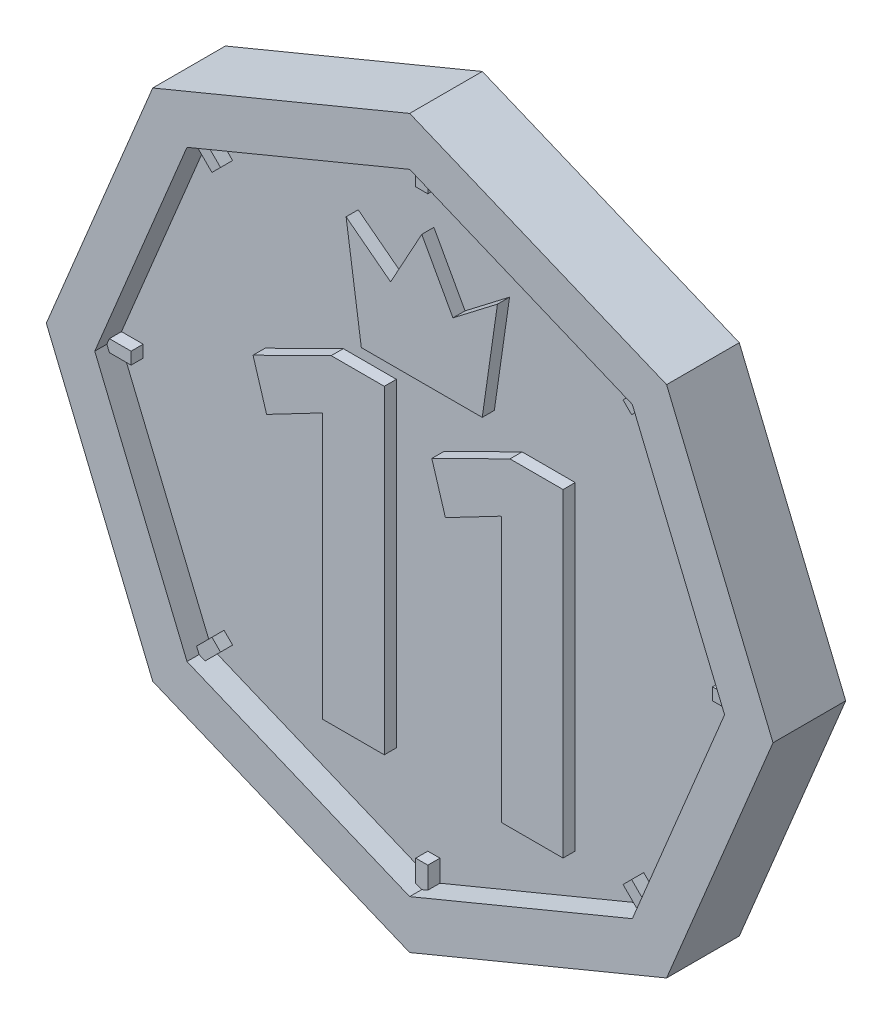
from build123d import *

# Parameters (mm, degrees)
BOSS_EXTRUDE2_DEPTH      = 2.54
BOSS_EXTRUDE3_DEPTH      = 5.08
BOSS_EXTRUDE3_DEPTH_BACK = 2.54
SKETCH2_W                = 1.27
SKETCH2_H                = 2.54
SKETCH2_W_2              = 2.54
SKETCH2_H_2              = 1.27
BOSS_EXTRUDE4_DEPTH      = 1.27
SKETCH4_W                = 46.629356418
SKETCH4_H                = 1.27
SKETCH4_W_2              = 1.27
SKETCH4_H_2              = 2.54
SKETCH4_W_3              = 2.54
BOSS_EXTRUDE5_DEPTH      = 1.27


with BuildPart() as part:
    # Sketch1 → Boss-Extrude2 (new body)
    with BuildSketch(Plane.XY):
        Polygon((23.348665915, -23.348665915), (33.02, 0), (23.348665915, 23.348665915), (0, 33.02), (-23.348665915, 23.348665915), (-33.02, 0), (-23.348665915, -23.348665915), (0, -33.02), align=None)
    extrude(amount=BOSS_EXTRUDE2_DEPTH)

    # Sketch1<3> → Boss-Extrude3 (add, two sides: drawn at the far end of the back side and taken through both)
    with BuildSketch(Plane.XY.offset(-BOSS_EXTRUDE3_DEPTH_BACK)):
        Polygon((-38.1, 0), (-26.940768363, -26.940768363), (0, -38.1), (26.940768363, -26.940768363), (38.1, 0), (26.940768363, 26.940768363), (0, 38.1), (-26.940768363, 26.940768363), align=None)
        Polygon((23.348665915, 23.348665915), (33.02, 0), (23.348665915, -23.348665915), (0, -33.02), (-23.348665915, -23.348665915), (-33.02, 0), (-23.348665915, 23.348665915), (0, 33.02), align=None, mode=Mode.SUBTRACT)
    extrude(amount=BOSS_EXTRUDE3_DEPTH + BOSS_EXTRUDE3_DEPTH_BACK)

    # Sketch2 → Boss-Extrude4 (add)
    with BuildSketch(Plane.XY.offset(2.54)):
        Polygon((-6.33928366, 13.03071018), (6.33928366, 13.03071018), (7.934955593, 24.113005041), (3.268356916, 20.533769163), (0, 26.484800243), (-3.268356916, 20.533769163), (-7.934955593, 24.113005041), align=None)
        Polygon((-23.797678721, -22.899653109), (-22.001627497, -21.103601885), (-21.103601885, -22.001627497), (-22.899653109, -23.797678721), align=None)
        with Locations((0, -31.75)):
            Rectangle(SKETCH2_W, SKETCH2_H)
        with Locations((-31.75, 0)):
            Rectangle(SKETCH2_W_2, SKETCH2_H_2)
        Polygon((-22.899653109, 23.797678721), (-21.103601885, 22.001627497), (-22.001627497, 21.103601885), (-23.797678721, 22.899653109), align=None)
        with Locations((0, 31.75)):
            Rectangle(SKETCH2_W, SKETCH2_H)
        Polygon((23.797678721, 22.899653109), (22.001627497, 21.103601885), (21.103601885, 22.001627497), (22.899653109, 23.797678721), align=None)
        with Locations((31.75, 0)):
            Rectangle(SKETCH2_W_2, SKETCH2_H_2)
        Polygon((22.899653109, -23.797678721), (21.103601885, -22.001627497), (22.001627497, -21.103601885), (23.797678721, -22.899653109), align=None)
        Polygon((-3.932009461, 10.718959088), (-9.498648774, 10.718959088), (-17.694490251, 6.662610839), (-16.270412432, 1.996482447), (-10.485096293, 5.022647812), (-10.396091429, 5.022647812), (-10.396091429, -22.746869658), (-3.932009461, -22.746869658), align=None)
        Polygon((14.816403577, 10.718959088), (9.249764264, 10.718959088), (1.053922787, 6.662610839), (2.478000606, 1.996482447), (8.263316745, 5.022647812), (8.352321609, 5.022647812), (8.352321609, -22.746869658), (14.816403577, -22.746869658), align=None)
    extrude(amount=BOSS_EXTRUDE4_DEPTH)

    # Sketch4 → Boss-Extrude5 (add)
    # profile 1 of 22: a face of its own
    with BuildSketch(Plane(origin=(0, 0, 0), x_dir=(-1, 0, 0), z_dir=(0, 0, -1))):
        with Locations((0, 16.421907481)):
            Rectangle(SKETCH4_W, SKETCH4_H)
    # profile 2 of 22: a face of its own
    with BuildSketch(Plane(origin=(0, 0, 0), x_dir=(-1, 0, 0), z_dir=(0, 0, -1))):
        with Locations((0, -7.79874833)):
            Rectangle(SKETCH4_W, SKETCH4_H)
    # profile 3 of 22: a face of its own
    with BuildSketch(Plane(origin=(0, 0, 0), x_dir=(-1, 0, 0), z_dir=(0, 0, -1))):
        Polygon((-4.468926018, 18.824161798), (4.468926018, 18.824161798), (5.630987553, 27.738580238), (2.060469106, 23.703632944), (0, 27.682107512), (-2.060469106, 23.703632944), (-5.630987553, 27.738580238), align=None)
    # profile 4 of 22: a face of its own
    with BuildSketch(Plane(origin=(0, 0, 0), x_dir=(-1, 0, 0), z_dir=(0, 0, -1))):
        with Locations((0, -31.75)):
            Rectangle(SKETCH4_W_2, SKETCH4_H_2)
    # profile 5 of 22: a face of its own
    with BuildSketch(Plane(origin=(0, 0, 0), x_dir=(-1, 0, 0), z_dir=(0, 0, -1))):
        Polygon((-23.797678721, -22.899653109), (-22.001627497, -21.103601885), (-21.103601885, -22.001627497), (-22.899653109, -23.797678721), align=None)
    # profile 6 of 22: a face of its own
    with BuildSketch(Plane(origin=(0, 0, 0), x_dir=(-1, 0, 0), z_dir=(0, 0, -1))):
        with Locations((-31.75, 0)):
            Rectangle(SKETCH4_W_3, SKETCH4_H)
    # profile 7 of 22: a face of its own
    with BuildSketch(Plane(origin=(0, 0, 0), x_dir=(-1, 0, 0), z_dir=(0, 0, -1))):
        Polygon((-22.899653109, 23.797678721), (-21.103601885, 22.001627497), (-22.001627497, 21.103601885), (-23.797678721, 22.899653109), align=None)
    # profile 8 of 22: a face of its own
    with BuildSketch(Plane(origin=(0, 0, 0), x_dir=(-1, 0, 0), z_dir=(0, 0, -1))):
        with Locations((0, 31.75)):
            Rectangle(SKETCH4_W_2, SKETCH4_H_2)
    # profile 9 of 22: a face of its own
    with BuildSketch(Plane(origin=(0, 0, 0), x_dir=(-1, 0, 0), z_dir=(0, 0, -1))):
        Polygon((23.797678721, 22.899653109), (22.001627497, 21.103601885), (21.103601885, 22.001627497), (22.899653109, 23.797678721), align=None)
    # profile 10 of 22: a face of its own
    with BuildSketch(Plane(origin=(0, 0, 0), x_dir=(-1, 0, 0), z_dir=(0, 0, -1))):
        with Locations((31.75, 0)):
            Rectangle(SKETCH4_W_3, SKETCH4_H)
    # profile 11 of 22: a face of its own
    with BuildSketch(Plane(origin=(0, 0, 0), x_dir=(-1, 0, 0), z_dir=(0, 0, -1))):
        Polygon((22.899653109, -23.797678721), (21.103601885, -22.001627497), (22.001627497, -21.103601885), (23.797678721, -22.899653109), align=None)
    # profile 12 of 22: a face of its own
    with BuildSketch(Plane(origin=(0, 0, 0), x_dir=(-1, 0, 0), z_dir=(0, 0, -1))):
        with BuildLine():
            Line((-18.98935306, -1.77944746), (-18.98935306, 11.191145991))
            Line((-18.98935306, 11.191145991), (-21.217252955, 11.191145991))
            add(Edge.make_bspline(
                [(-21.217252955, 11.191145991), (-21.268482799, 11.189194693), (-21.367299755, 11.185430846), (-21.506094139, 11.144780414), (-21.62157244, 11.071347915), (-21.717007162, 10.971052384), (-21.789807118, 10.843331433), (-21.83861186, 10.686879818), (-21.872740438, 10.506484111), (-21.873867563, 10.375674968), (-21.874462757, 10.306599465)],
                knots=[0, 0, 0, 0, 0.977224629, 1.884963059, 2.724894201, 3.562760105, 4.506432734, 5.505399502, 6.682693129, 8, 8, 8, 8], degree=3))
            Line((-21.874462757, 10.306599465), (-21.874462757, 8.963246096))
            Line((-21.874462757, 8.963246096), (-24.788506219, 9.161649055))
            Line((-24.788506219, 9.161649055), (-24.788506219, 14.018388158))
            Line((-24.788506219, 14.018388158), (-9.846283362, 14.018388158))
            Line((-9.846283362, 14.018388158), (-9.846283362, 9.161649055))
            Line((-9.846283362, 9.161649055), (-12.760326824, 8.963246096))
            Line((-12.760326824, 8.963246096), (-12.760326824, 10.306599465))
            add(Edge.make_bspline(
                [(-12.760326824, 10.306599465), (-12.761262983, 10.381105346), (-12.76300524, 10.519765867), (-12.791577914, 10.710142017), (-12.83544146, 10.865225412), (-12.897444648, 10.993091857), (-13.004718014, 11.087539278), (-13.156501709, 11.152886172), (-13.358346852, 11.185261951), (-13.508381118, 11.189054204), (-13.591139215, 11.191145991)],
                knots=[0, 0, 0, 0, 1.236998566, 2.302138631, 3.185769551, 3.912918455, 4.625875948, 5.506834142, 6.624783066, 8, 8, 8, 8], degree=3))
            Line((-13.591139215, 11.191145991), (-15.533834856, 11.191145991))
            Line((-15.533834856, 11.191145991), (-15.533834856, -2.465591027))
            Line((-15.533834856, -2.465591027), (-13.277001196, -2.548258926))
            Line((-13.277001196, -2.548258926), (-13.277001196, -4.978695175))
            Line((-13.277001196, -4.978695175), (-21.332988015, -4.978695175))
            Line((-21.332988015, -4.978695175), (-21.332988015, -2.663993986))
            Line((-21.332988015, -2.663993986), (-19.820165451, -2.577192691))
            add(Edge.make_bspline(
                [(-19.820165451, -2.577192691), (-19.754986329, -2.569783262), (-19.630809871, -2.555667137), (-19.461026135, -2.501065793), (-19.31696119, -2.428834885), (-19.192161718, -2.343832728), (-19.10031648, -2.229135548), (-19.038238125, -2.095348105), (-18.994010236, -1.944800602), (-18.990954089, -1.836292018), (-18.98935306, -1.77944746)],
                knots=[0, 0, 0, 0, 1.218079664, 2.32063295, 3.295056221, 4.212876684, 5.105656009, 5.988443292, 6.946202713, 8, 8, 8, 8], degree=3))
        make_face()
    # profile 13 of 22: a face of its own
    with BuildSketch(Plane(origin=(0, 0, 0), x_dir=(-1, 0, 0), z_dir=(0, 0, -1))):
        with BuildLine():
            add(Edge.make_bspline(
                [(-0.361795238, 14.361459942), (-0.084499984, 14.35448915), (0.460012804, 14.340800905), (1.259792736, 14.227585089), (2.022924903, 14.035008602), (2.755542478, 13.776947961), (3.449560651, 13.433399732), (4.110171923, 13.017853686), (4.73611547, 12.52755466), (5.32520929, 11.964400208), (5.864274495, 11.325927202), (6.330637024, 10.601699714), (6.722348487, 9.798870837), (7.045384918, 8.9181461), (7.290408833, 7.957928091), (7.467058112, 6.919746982), (7.571117811, 5.803485865), (7.607679646, 4.63415947), (7.569587998, 3.463854378), (7.472420659, 2.341522542), (7.292952767, 1.294398577), (7.050253586, 0.319903528), (6.723602163, -0.577711351), (6.339259027, -1.406268533), (5.872274323, -2.155549173), (5.338067933, -2.826803767), (4.742908175, -3.421111479), (4.097907312, -3.939558379), (3.400513324, -4.378388753), (2.652272411, -4.734499465), (1.853714505, -5.011650861), (1.006186902, -5.21138284), (0.108477254, -5.322383911), (-0.820614326, -5.365199406), (-1.748267175, -5.322408769), (-2.642169518, -5.212237879), (-3.481685956, -5.010308788), (-4.273962691, -4.739879368), (-5.010794493, -4.38239059), (-5.697806555, -3.949275842), (-6.326393965, -3.431591829), (-6.909481339, -2.844436115), (-7.426010789, -2.176237869), (-7.874491608, -1.435450687), (-8.250837268, -0.622234548), (-8.560699322, 0.260806508), (-8.797853473, 1.216203666), (-8.970435103, 2.239932519), (-9.074935238, 3.335517316), (-9.085882475, 4.089736042), (-9.091525438, 4.478512542)],
                knots=[0, 0, 0, 0, 0.915382714, 1.797497739, 2.660384924, 3.510865206, 4.357295791, 5.211855023, 6.083726819, 6.978272765, 7.898650429, 8.836273308, 9.814952259, 10.84267508, 11.928501812, 13.082599651, 14.316669705, 15.627589643, 16.943056954, 18.181229506, 19.344295857, 20.447745948, 21.492566699, 22.493857774, 23.458369669, 24.400529174, 25.320603182, 26.230076371, 27.127556133, 28.035149761, 28.960327634, 29.913788544, 30.904721032, 31.943023514, 32.981325995, 33.967746822, 34.912352744, 35.827441454, 36.726833421, 37.610343502, 38.502804526, 39.410033182, 40.337367507, 41.284599284, 42.263616572, 43.290996949, 44.370159905, 45.510037374, 46.716501036, 48, 48, 48, 48], degree=3))
            add(Edge.make_bspline(
                [(-9.091525438, 4.478512542), (-9.089400016, 4.694898706), (-9.085227143, 5.119732784), (-9.044714154, 5.746821668), (-8.991125052, 6.354333957), (-8.901187461, 6.941102598), (-8.796032422, 7.508640679), (-8.662518052, 8.056090288), (-8.507444487, 8.583834456), (-8.324149688, 9.089385562), (-8.122011611, 9.56981609), (-7.908441547, 10.02651455), (-7.67621591, 10.451979903), (-7.431514769, 10.851248766), (-7.173599757, 11.223614167), (-6.893227803, 11.563854116), (-6.602139006, 11.879076139), (-6.392472591, 12.068892938), (-6.289083641, 12.162493812)],
                knots=[0, 0, 0, 0, 1.233193321, 2.421146243, 3.580805196, 4.708102709, 5.803208848, 6.869870998, 7.918455784, 8.936965639, 9.933128306, 10.888652697, 11.809366411, 12.694283943, 13.557039734, 14.388637188, 15.20541824, 16, 16, 16, 16], degree=3))
            add(Edge.make_bspline(
                [(-6.289083641, 12.162493812), (-6.075814052, 12.338715313), (-5.654749155, 12.686634997), (-4.975834833, 13.134391531), (-4.27053444, 13.510987977), (-3.541150698, 13.82371307), (-2.783495739, 14.063735996), (-2.00087324, 14.237337174), (-1.190052724, 14.344046541), (-0.640436643, 14.355601746), (-0.361795238, 14.361459942)],
                knots=[0, 0, 0, 0, 1.026688266, 2.027023128, 3.013499639, 3.992251704, 4.969491727, 5.959992852, 6.96576815, 8, 8, 8, 8], degree=3))
        make_face()
        with BuildLine():
            add(Edge.make_bspline(
                [(-5.520272175, 4.619047971), (-5.516251572, 4.332366315), (-5.508472319, 3.777680965), (-5.450450472, 2.974583749), (-5.355789385, 2.226616923), (-5.227078709, 1.532240161), (-5.053314818, 0.893883429), (-4.842853262, 0.309242116), (-4.592508215, -0.218459646), (-4.304538842, -0.693480233), (-3.978636049, -1.112663011), (-3.610783482, -1.477083503), (-3.203920711, -1.785221652), (-2.756419982, -2.034129083), (-2.273828336, -2.230612141), (-1.751056113, -2.36522189), (-1.191196905, -2.449304151), (-0.804378802, -2.460063709), (-0.605665542, -2.465591027)],
                knots=[0, 0, 0, 0, 1.404388501, 2.717277891, 3.942141577, 5.09651568, 6.173968345, 7.179706107, 8.136791145, 9.030486387, 9.896003801, 10.731277159, 11.56017147, 12.388213363, 13.233032392, 14.105679567, 15.026864082, 16, 16, 16, 16], degree=3))
            add(Edge.make_bspline(
                [(-0.605665542, -2.465591027), (-0.394345744, -2.460213012), (0.014487362, -2.449808353), (0.602865227, -2.342092388), (1.145519158, -2.177461726), (1.633758536, -1.930890942), (2.08131019, -1.630541701), (2.465761896, -1.2446203), (2.811009274, -0.800883497), (2.989769944, -0.463974345), (3.081322781, -0.291425267)],
                knots=[0, 0, 0, 0, 1.115810488, 2.15871997, 3.151471766, 4.102528743, 5.039878908, 5.987499782, 6.969291701, 8, 8, 8, 8], degree=3))
            add(Edge.make_bspline(
                [(3.081322781, -0.291425267), (3.159319358, -0.128450469), (3.31698068, 0.200984785), (3.515370013, 0.720213552), (3.67979254, 1.267814833), (3.815177421, 1.842192833), (3.923784368, 2.442142905), (3.996115433, 3.068988376), (4.042755465, 3.721395412), (4.04932706, 4.165670112), (4.052670602, 4.391711247)],
                knots=[0, 0, 0, 0, 0.898222309, 1.81565554, 2.760689363, 3.7395434, 4.748880663, 5.790807692, 6.875991952, 8, 8, 8, 8], degree=3))
            add(Edge.make_bspline(
                [(4.052670602, 4.391711247), (4.043069432, 4.798808846), (4.024211823, 5.598387187), (3.853951224, 6.77077381), (3.600894552, 7.898388595), (3.330874982, 8.610390145), (3.19705784, 8.963246096)],
                knots=[0, 0, 0, 0, 1.043411596, 2.049359458, 3.033295468, 4, 4, 4, 4], degree=3))
            add(Edge.make_bspline(
                [(3.19705784, 8.963246096), (3.109835918, 9.146577401), (2.938746011, 9.506190384), (2.596799091, 9.992419437), (2.194446591, 10.41793889), (1.723979103, 10.77673632), (1.191250395, 11.072726411), (0.578188642, 11.272737318), (-0.103078919, 11.394102059), (-0.71146907, 11.426789304), (-1.214805768, 11.408599967), (-1.587811626, 11.357143578), (-1.948314532, 11.280755681), (-2.294257732, 11.167630984), (-2.626340046, 11.022132397), (-2.945578673, 10.844768849), (-3.247694478, 10.631171585), (-3.63198478, 10.313115973), (-4.060374451, 9.861886845), (-4.503581107, 9.266965275), (-4.846544736, 8.609357481), (-5.107799891, 7.901281343), (-5.286266149, 7.143019639), (-5.425790156, 6.344262841), (-5.50228049, 5.496805141), (-5.514169232, 4.916791181), (-5.520272175, 4.619047971)],
                knots=[0, 0, 0, 0, 1.021933598, 2.004570844, 2.982188073, 3.962933528, 4.976192254, 6.039215585, 7.197152445, 8.456176752, 9.102690866, 9.733303575, 10.351790212, 10.95798781, 11.564463855, 12.176994324, 12.795480961, 13.426858141, 14.689249546, 15.921416898, 17.154836373, 18.414013926, 19.716131541, 21.076036175, 22.499018238, 24, 24, 24, 24], degree=3))
        make_face(mode=Mode.SUBTRACT)
    # profile 14 of 22: a face of its own
    with BuildSketch(Plane(origin=(0, 0, 0), x_dir=(-1, 0, 0), z_dir=(0, 0, -1))):
        with BuildLine():
            Line((24.040115372, 1.676070744), (24.040115372, -3.494806377))
            add(Edge.make_bspline(
                [(24.040115372, -3.494806377), (23.815513257, -3.642751425), (23.364823128, -3.939620281), (22.63390398, -4.303250085), (21.868405701, -4.620611141), (21.059623433, -4.873715489), (20.214045943, -5.079843395), (19.325985418, -5.216249853), (18.398533575, -5.303836026), (17.445921549, -5.331859296), (16.498835871, -5.30026016), (15.589538294, -5.185037934), (14.734255244, -4.992901835), (13.934131979, -4.717365575), (13.186777384, -4.369486649), (12.489093871, -3.94795193), (11.855158049, -3.435876166), (11.268081099, -2.857170228), (10.746296986, -2.198614105), (10.298243225, -1.460619711), (9.912444528, -0.654472189), (9.604717664, 0.23104807), (9.359105151, 1.187398422), (9.197605645, 2.220186187), (9.083356249, 3.324122979), (9.073860173, 4.085517089), (9.068958751, 4.478512542)],
                knots=[0, 0, 0, 0, 0.89485755, 1.795635202, 2.713256254, 3.652058756, 4.614641704, 5.608798745, 6.641027956, 7.715111432, 8.780339177, 9.793300775, 10.762726094, 11.694224118, 12.605572594, 13.503389213, 14.401205832, 15.312842985, 16.243628894, 17.191035791, 18.18224529, 19.213984954, 20.307847166, 21.465654487, 22.691891298, 24, 24, 24, 24], degree=3))
            add(Edge.make_bspline(
                [(9.068958751, 4.478512542), (9.07410841, 4.827424542), (9.084149023, 5.507720153), (9.197191553, 6.500717873), (9.366485278, 7.441550733), (9.610091613, 8.324666121), (9.913462554, 9.141852939), (10.251843213, 9.891233382), (10.639263253, 10.564239743), (11.071233878, 11.164620903), (11.550719916, 11.698350898), (12.051809645, 12.195697025), (12.601900648, 12.634076628), (12.991004301, 12.89273518), (13.185820152, 13.022239968)],
                knots=[0, 0, 0, 0, 1.264731503, 2.465926336, 3.619368682, 4.72849992, 5.782891146, 6.777797955, 7.706786795, 8.594298836, 9.45445623, 10.305979455, 11.151840258, 12, 12, 12, 12], degree=3))
            add(Edge.make_bspline(
                [(13.185820152, 13.022239968), (13.378710404, 13.129589128), (13.763450615, 13.343708493), (14.365279136, 13.617697441), (14.987448572, 13.84219056), (15.624911353, 14.036619993), (16.285129611, 14.177613562), (16.96207887, 14.287832782), (17.659751782, 14.348173471), (18.370390217, 14.36697859), (19.08532296, 14.352931597), (19.792746535, 14.292333919), (20.489728977, 14.202673278), (21.174492886, 14.075443871), (21.845636612, 13.907995937), (22.506433695, 13.710636171), (23.153339939, 13.471704039), (23.573988284, 13.284902361), (23.783844884, 13.191709162)],
                knots=[0, 0, 0, 0, 0.962951813, 1.920710241, 2.881181764, 3.847412023, 4.826166394, 5.824408197, 6.838401579, 7.878870305, 8.925192871, 9.956643373, 10.975242001, 11.990446504, 12.993600091, 13.992077199, 14.998270516, 16, 16, 16, 16], degree=3))
            Line((23.783844884, 13.191709162), (23.783844884, 8.334970059))
            Line((23.783844884, 8.334970059), (20.869801422, 8.1365671))
            Line((20.869801422, 8.1365671), (20.869801422, 10.364466995))
            add(Edge.make_bspline(
                [(20.869801422, 10.364466995), (20.867939332, 10.430643033), (20.86443783, 10.555081425), (20.846404784, 10.727352073), (20.809803748, 10.872410794), (20.771735277, 10.95459736), (20.754066362, 10.992743032)],
                knots=[0, 0, 0, 0, 1.232055725, 2.316775653, 3.218756464, 4, 4, 4, 4], degree=3))
            add(Edge.make_bspline(
                [(20.754066362, 10.992743032), (20.720824701, 11.03829844), (20.646999186, 11.139471228), (20.45951152, 11.238381612), (20.22779159, 11.336514842), (19.929241226, 11.404166727), (19.574108814, 11.468268143), (19.155042971, 11.505253968), (18.675301334, 11.530412893), (18.334700183, 11.532899645), (18.154160919, 11.534217774)],
                knots=[0, 0, 0, 0, 0.490716836, 1.089819888, 1.824069302, 2.712434388, 3.771231139, 5.002197861, 6.410983076, 8, 8, 8, 8], degree=3))
            add(Edge.make_bspline(
                [(18.154160919, 11.534217774), (17.930655711, 11.530569888), (17.497146138, 11.523494465), (16.870601431, 11.437248917), (16.285858589, 11.306351918), (15.743456798, 11.122858507), (15.245030057, 10.878794065), (14.787866824, 10.585853573), (14.374718721, 10.235733251), (14.009472196, 9.8283583), (13.680850573, 9.374723081), (13.403907673, 8.861254269), (13.164430476, 8.300015376), (12.969650041, 7.682637046), (12.824170312, 7.012511736), (12.717798565, 6.290301824), (12.64996367, 5.515910761), (12.643531023, 4.981556398), (12.640212014, 4.705849266)],
                knots=[0, 0, 0, 0, 1.068258036, 2.071987886, 3.018333858, 3.931091984, 4.80344547, 5.666188711, 6.521754935, 7.384800116, 8.277231826, 9.194427351, 10.168718072, 11.191985408, 12.285552558, 13.444884619, 14.681654752, 16, 16, 16, 16], degree=3))
            add(Edge.make_bspline(
                [(12.640212014, 4.705849266), (12.644159199, 4.415021874), (12.651799928, 3.852055291), (12.710987629, 3.035403802), (12.802196384, 2.274158995), (12.939884935, 1.568951415), (13.109834102, 0.917866966), (13.325707642, 0.324994122), (13.575652342, -0.213457229), (13.873435512, -0.691930029), (14.200898819, -1.120807861), (14.574707272, -1.489299027), (14.9853686, -1.801752431), (15.437039905, -2.054739847), (15.924879493, -2.255939), (16.453113711, -2.394618883), (17.020316666, -2.478241688), (17.411230454, -2.48898716), (17.612686177, -2.494524792)],
                knots=[0, 0, 0, 0, 1.404093699, 2.717962122, 3.951567485, 5.103621193, 6.184807657, 7.197075335, 8.14637199, 9.0454833, 9.913106436, 10.745745791, 11.572008966, 12.397173369, 13.238484631, 14.113118772, 15.027603957, 16, 16, 16, 16], degree=3))
            add(Edge.make_bspline(
                [(17.612686177, -2.494524792), (17.772544377, -2.491515442), (18.082873283, -2.485673464), (18.53430368, -2.458655938), (18.95712933, -2.40610037), (19.349691755, -2.325729409), (19.715212458, -2.232746172), (20.052936153, -2.116461436), (20.36309013, -1.979037904), (20.551231655, -1.864111165), (20.642464698, -1.808381225)],
                knots=[0, 0, 0, 0, 1.219055175, 2.366522706, 3.446760331, 4.464555673, 5.420101886, 6.32046166, 7.185563142, 8, 8, 8, 8], degree=3))
            Line((20.642464698, -1.808381225), (20.642464698, 2.449015606))
            Line((20.642464698, 2.449015606), (20.613530933, 2.449015606))
            Line((20.613530933, 2.449015606), (18.414564803, 2.535816901))
            Line((18.414564803, 2.535816901), (18.414564803, 4.962119754))
            Line((18.414564803, 4.962119754), (25.528137566, 4.962119754))
            Line((25.528137566, 4.962119754), (25.528137566, 2.67635233))
            Line((25.528137566, 2.67635233), (24.870927764, 2.622618195))
            add(Edge.make_bspline(
                [(24.870927764, 2.622618195), (24.800240634, 2.612098538), (24.668237825, 2.592453884), (24.489841195, 2.53748958), (24.339717513, 2.474174508), (24.222113792, 2.383973537), (24.131615369, 2.262485873), (24.078391124, 2.101307516), (24.046343588, 1.901972339), (24.042323253, 1.756152066), (24.040115372, 1.676070744)],
                knots=[0, 0, 0, 0, 1.186267568, 2.215263958, 3.096781176, 3.880294166, 4.649956514, 5.577587387, 6.669663702, 8, 8, 8, 8], degree=3))
        make_face()
    # profile 15 of 22: a face of its own
    with BuildSketch(Plane(origin=(0, 0, 0), x_dir=(-1, 0, 0), z_dir=(0, 0, -1))):
        with BuildLine():
            add(Edge.make_bspline(
                [(-17.255883649, -14.075309535), (-17.266733587, -14.059886695), (-17.290353518, -14.026311719), (-17.349364532, -13.992143227), (-17.421521888, -13.958430065), (-17.513832859, -13.935764325), (-17.622319594, -13.913649343), (-17.749868555, -13.901023921), (-17.895195374, -13.892547812), (-17.998361665, -13.891670417), (-18.052719534, -13.891208122)],
                knots=[0, 0, 0, 0, 0.531632017, 1.157344134, 1.904191246, 2.804553967, 3.851774823, 5.060608256, 6.451247335, 8, 8, 8, 8], degree=3))
            add(Edge.make_bspline(
                [(-18.052719534, -13.891208122), (-18.125892962, -13.893095562), (-18.268119295, -13.896764156), (-18.4749122, -13.925247951), (-18.668062678, -13.972092219), (-18.846962234, -14.040640055), (-19.012952919, -14.126654885), (-19.165818394, -14.232092451), (-19.302748043, -14.359273887), (-19.427158716, -14.503197946), (-19.536884345, -14.665528332), (-19.631005592, -14.845500104), (-19.710979329, -15.041830588), (-19.777173352, -15.254722073), (-19.827006983, -15.484805009), (-19.863121213, -15.731766865), (-19.886122574, -15.995524913), (-19.888365897, -16.177201916), (-19.889517595, -16.270472941)],
                knots=[0, 0, 0, 0, 1.027425039, 1.996993952, 2.925720651, 3.812847462, 4.680984233, 5.546098955, 6.412238858, 7.298584576, 8.21284234, 9.157581752, 10.146031387, 11.186539837, 12.284833024, 13.448872937, 14.690278722, 16, 16, 16, 16], degree=3))
            add(Edge.make_bspline(
                [(-19.889517595, -16.270472941), (-19.888268209, -16.367483784), (-19.885850764, -16.555190662), (-19.864494431, -16.827363858), (-19.82998907, -17.080928474), (-19.781105226, -17.316335397), (-19.718535733, -17.533317316), (-19.641061598, -17.731468895), (-19.550143842, -17.910960896), (-19.444005224, -18.071322857), (-19.323856259, -18.213021611), (-19.189831379, -18.336582984), (-19.040730821, -18.439408612), (-18.878670867, -18.524913676), (-18.702090921, -18.59105629), (-18.510866319, -18.636634463), (-18.306079795, -18.665326445), (-18.164778516, -18.668952318), (-18.092069454, -18.670818075)],
                knots=[0, 0, 0, 0, 1.361698404, 2.634758638, 3.829861646, 4.95197018, 6.007077495, 6.996264085, 7.934492997, 8.826405018, 9.689509838, 10.536658188, 11.377658048, 12.224857448, 13.103087527, 14.017032482, 14.979629123, 16, 16, 16, 16], degree=3))
            add(Edge.make_bspline(
                [(-18.092069454, -18.670818075), (-18.083168859, -18.670817583), (-18.056935528, -18.670816132), (-18.004938211, -18.670838677), (-17.928106787, -18.67068522), (-17.793991613, -18.671823341), (-17.613665223, -18.662066391), (-17.438740045, -18.62174462), (-17.316019158, -18.578404262), (-17.244160077, -18.547465828), (-17.19199762, -18.515594769), (-17.158200513, -18.478882437), (-17.141856201, -18.435131336), (-17.129039929, -18.386244696), (-17.122670083, -18.327119634), (-17.121567915, -18.284820679), (-17.120969637, -18.261859975)],
                knots=[0, 0, 0, 0, 0.312638408, 0.92146057, 1.826466487, 3.011201505, 5.633744911, 8.148509054, 9.28304515, 10.203623799, 10.892757555, 11.417503638, 11.918763254, 12.51341174, 13.193050662, 14, 14, 14, 14], degree=3))
            Line((-17.120969637, -18.261859975), (-17.120969637, -17.484699051))
            Line((-17.120969637, -17.484699051), (-16.13019486, -17.553561411))
            Line((-16.13019486, -17.553561411), (-16.13019486, -19.232959792))
            add(Edge.make_bspline(
                [(-16.13019486, -19.232959792), (-16.194761688, -19.265579908), (-16.326081955, -19.331924848), (-16.536585032, -19.409701971), (-16.757634326, -19.479601857), (-16.992029921, -19.535472745), (-17.239376003, -19.578900444), (-17.499389974, -19.608733552), (-17.771769127, -19.629886387), (-17.957580535, -19.631337443), (-18.052719534, -19.632080412)],
                knots=[0, 0, 0, 0, 0.875107143, 1.779850544, 2.712600346, 3.680979655, 4.694490943, 5.751071419, 6.848505513, 8, 8, 8, 8], degree=3))
            add(Edge.make_bspline(
                [(-18.052719534, -19.632080412), (-18.173222734, -19.62989774), (-18.407417409, -19.625655779), (-18.747482826, -19.585825097), (-19.065448717, -19.519992801), (-19.361792017, -19.429000849), (-19.636661972, -19.312473229), (-19.888987079, -19.167997346), (-20.119078766, -18.997114758), (-20.32761172, -18.800727376), (-20.510929201, -18.576840455), (-20.670340357, -18.3276423), (-20.805813679, -18.053436888), (-20.914718868, -17.753382439), (-21.000836662, -17.42847001), (-21.059485319, -17.077934632), (-21.096868186, -16.702256977), (-21.101402955, -16.443425913), (-21.103743705, -16.309822861)],
                knots=[0, 0, 0, 0, 1.121093534, 2.178814616, 3.18088755, 4.139247195, 5.059155523, 5.953534805, 6.838536075, 7.720525664, 8.612521746, 9.524336882, 10.467977559, 11.452774883, 12.490139317, 13.591737059, 14.756906246, 16, 16, 16, 16], degree=3))
            add(Edge.make_bspline(
                [(-21.103743705, -16.309822861), (-21.103004998, -16.234847617), (-21.10154959, -16.087130554), (-21.087955182, -15.869692829), (-21.069589485, -15.659406507), (-21.039034894, -15.457090671), (-21.0032412, -15.261333999), (-20.958090737, -15.072794096), (-20.905156943, -14.89153586), (-20.84274721, -14.718290026), (-20.774364664, -14.553161278), (-20.70002527, -14.396798531), (-20.619378484, -14.250206295), (-20.534703773, -14.112355788), (-20.441672368, -13.98532422), (-20.346172923, -13.86521357), (-20.241257033, -13.757162153), (-20.167672915, -13.690785161), (-20.131238534, -13.657919309)],
                knots=[0, 0, 0, 0, 1.235980129, 2.435141844, 3.591014803, 4.714965851, 5.807154358, 6.871207412, 7.909869871, 8.918816805, 9.905645509, 10.855669653, 11.771647661, 12.66320399, 13.52065367, 14.366229023, 15.191055936, 16, 16, 16, 16], degree=3))
            add(Edge.make_bspline(
                [(-20.131238534, -13.657919309), (-20.05771974, -13.599913537), (-19.911419715, -13.484483922), (-19.676107829, -13.335761004), (-19.430344481, -13.210288273), (-19.175252237, -13.106751004), (-18.908996979, -13.028559113), (-18.633335604, -12.970426392), (-18.346364542, -12.936243634), (-18.151653525, -12.932067637), (-18.052719534, -12.929945785)],
                knots=[0, 0, 0, 0, 0.998910034, 1.987798715, 2.964889366, 3.940610512, 4.921314096, 5.922411121, 6.94436297, 8, 8, 8, 8], degree=3))
            add(Edge.make_bspline(
                [(-18.052719534, -12.929945785), (-17.972566322, -12.930753205), (-17.812947758, -12.932361116), (-17.575249943, -12.953725075), (-17.341008872, -12.983578104), (-17.110649421, -13.027553327), (-16.884346591, -13.08434542), (-16.660432063, -13.150915842), (-16.441190054, -13.23279189), (-16.298534086, -13.296025646), (-16.227164306, -13.32766105)],
                knots=[0, 0, 0, 0, 1.021149204, 2.033535123, 3.039138994, 4.029691299, 5.020081677, 6.011622962, 7.005228931, 8, 8, 8, 8], degree=3))
            Line((-16.227164306, -13.32766105), (-16.227164306, -14.978952345))
            Line((-16.227164306, -14.978952345), (-17.217939083, -15.046409352))
            Line((-17.217939083, -15.046409352), (-17.217939083, -14.288923387))
            add(Edge.make_bspline(
                [(-17.217939083, -14.288923387), (-17.218509173, -14.266407757), (-17.219581179, -14.224069036), (-17.226463234, -14.165801123), (-17.236602884, -14.11602433), (-17.249756126, -14.088248898), (-17.255883649, -14.075309535)],
                knots=[0, 0, 0, 0, 1.23397436, 2.320383484, 3.217539862, 4, 4, 4, 4], degree=3))
        make_face()
    # profile 16 of 22: a face of its own
    with BuildSketch(Plane(origin=(0, 0, 0), x_dir=(-1, 0, 0), z_dir=(0, 0, -1))):
        with BuildLine():
            Line((-14.731867338, -18.417854302), (-14.731867338, -13.68743175))
            add(Edge.make_bspline(
                [(-14.731867338, -13.68743175), (-14.732232709, -13.663509274), (-14.732909953, -13.619167051), (-14.741916009, -13.558811092), (-14.758564723, -13.510167301), (-14.783549968, -13.472523734), (-14.817902354, -13.444566078), (-14.861672899, -13.425408002), (-14.914749946, -13.411265161), (-14.953812774, -13.407173914), (-14.974993631, -13.404955537)],
                knots=[0, 0, 0, 0, 1.331676089, 2.468368191, 3.384538633, 4.17334033, 4.951716876, 5.815490653, 6.81550363, 8, 8, 8, 8], degree=3))
            Line((-14.974993631, -13.404955537), (-15.31508937, -13.385280577))
            Line((-15.31508937, -13.385280577), (-15.31508937, -12.580012566))
            Line((-15.31508937, -12.580012566), (-13.586503588, -12.580012566))
            Line((-13.586503588, -12.580012566), (-13.586503588, -15.192566198))
            add(Edge.make_bspline(
                [(-13.586503588, -15.192566198), (-13.543233863, -15.135337804), (-13.458582777, -15.023378561), (-13.312710799, -14.875286726), (-13.152179982, -14.752981717), (-12.980849794, -14.649796245), (-12.795266456, -14.571105809), (-12.597440064, -14.515199687), (-12.387087971, -14.480366001), (-12.242655385, -14.476443854), (-12.168501106, -14.474430154)],
                knots=[0, 0, 0, 0, 1.038484631, 2.031647991, 2.999289289, 3.954648889, 4.921314346, 5.909248965, 6.926570943, 8, 8, 8, 8], degree=3))
            add(Edge.make_bspline(
                [(-12.168501106, -14.474430154), (-12.108479035, -14.475783981), (-11.991847786, -14.478414656), (-11.822182322, -14.498647481), (-11.662886217, -14.530082634), (-11.513877003, -14.576576762), (-11.376099785, -14.637826085), (-11.246799287, -14.708872542), (-11.129301523, -14.795440586), (-11.023540111, -14.895888657), (-10.928992663, -15.009188881), (-10.845399977, -15.134436867), (-10.776266512, -15.273964342), (-10.720639958, -15.426924885), (-10.675283357, -15.592228367), (-10.645649666, -15.771211903), (-10.624709775, -15.9626711), (-10.623326075, -16.095209078), (-10.622611383, -16.163666015)],
                knots=[0, 0, 0, 0, 1.101489928, 2.140348435, 3.131939574, 4.078358154, 4.998593909, 5.895596781, 6.781318237, 7.669374052, 8.566665383, 9.484849955, 10.427001046, 11.417323736, 12.468634274, 13.568478357, 14.744099421, 16, 16, 16, 16], degree=3))
            Line((-10.622611383, -16.163666015), (-10.622611383, -18.698925161))
            Line((-10.622611383, -18.698925161), (-10.070307146, -18.728437601))
            Line((-10.070307146, -18.728437601), (-10.070307146, -19.505598525))
            Line((-10.070307146, -19.505598525), (-12.382114959, -19.505598525))
            Line((-12.382114959, -19.505598525), (-12.382114959, -18.767787521))
            Line((-12.382114959, -18.767787521), (-12.060288826, -18.738275081))
            add(Edge.make_bspline(
                [(-12.060288826, -18.738275081), (-12.037646286, -18.734701011), (-11.995061833, -18.72797916), (-11.936996859, -18.708774063), (-11.886636205, -18.687904537), (-11.8466719, -18.656760194), (-11.814709621, -18.615833769), (-11.793157654, -18.56153189), (-11.781140183, -18.493802867), (-11.779895189, -18.444611994), (-11.779217967, -18.417854302)],
                knots=[0, 0, 0, 0, 1.13274744, 2.130389526, 3.023009143, 3.816390203, 4.609771263, 5.566113547, 6.676071785, 8, 8, 8, 8], degree=3))
            Line((-11.779217967, -18.417854302), (-11.779217967, -16.416629788))
            add(Edge.make_bspline(
                [(-11.779217967, -16.416629788), (-11.780936747, -16.337382051), (-11.784184568, -16.187634929), (-11.812451617, -15.976795558), (-11.862779106, -15.795197351), (-11.920823783, -15.662615119), (-11.983110636, -15.575279134), (-12.036354279, -15.517288546), (-12.102793735, -15.471924041), (-12.175652173, -15.431636999), (-12.259282494, -15.402231591), (-12.351776345, -15.381752082), (-12.453902678, -15.369229772), (-12.562458658, -15.365644373), (-12.672992692, -15.369019947), (-12.780147982, -15.383463798), (-12.881397951, -15.405534297), (-12.977099967, -15.436797015), (-13.066742648, -15.477201012), (-13.150446375, -15.527562107), (-13.229881094, -15.584446348), (-13.323507679, -15.674460115), (-13.425405948, -15.799045732), (-13.513390951, -15.968782272), (-13.568048171, -16.154245073), (-13.573749795, -16.283209161), (-13.576666108, -16.349172782)],
                knots=[0, 0, 0, 0, 1.842534757, 3.481667603, 4.930098868, 6.216653691, 6.81815347, 7.419159852, 8.035855349, 8.679201932, 9.351147495, 10.088435054, 10.878851464, 11.740037082, 12.612108185, 13.447129678, 14.250574784, 15.01876008, 15.784159843, 16.531438746, 17.287479285, 18.050394482, 19.545785718, 21.007469146, 22.469355514, 24, 24, 24, 24], degree=3))
            Line((-13.576666108, -16.349172782), (-13.576666108, -18.698925161))
            Line((-13.576666108, -18.698925161), (-13.022956517, -18.728437601))
            Line((-13.022956517, -18.728437601), (-13.022956517, -19.505598525))
            Line((-13.022956517, -19.505598525), (-15.33476433, -19.505598525))
            Line((-15.33476433, -19.505598525), (-15.33476433, -18.767787521))
            Line((-15.33476433, -18.767787521), (-15.014343551, -18.738275081))
            add(Edge.make_bspline(
                [(-15.014343551, -18.738275081), (-14.991223506, -18.734743923), (-14.948142859, -18.728164153), (-14.889647651, -18.708765132), (-14.839285258, -18.687906535), (-14.799321351, -18.656759689), (-14.767358966, -18.615833935), (-14.745807033, -18.561531835), (-14.733789551, -18.493802886), (-14.732544559, -18.444612001), (-14.731867338, -18.417854302)],
                knots=[0, 0, 0, 0, 1.152268046, 2.147074271, 3.037156559, 3.828282382, 4.619408206, 5.573032026, 6.679835136, 8, 8, 8, 8], degree=3))
        make_face()
    # profile 17 of 22: a face of its own
    with BuildSketch(Plane(origin=(0, 0, 0), x_dir=(-1, 0, 0), z_dir=(0, 0, -1))):
        with BuildLine():
            Line((-5.116433261, -14.814525893), (-5.116433261, -18.427691782))
            add(Edge.make_bspline(
                [(-5.116433261, -18.427691782), (-5.116399642, -18.45168373), (-5.116337861, -18.495773535), (-5.103614409, -18.555249244), (-5.09038993, -18.60478435), (-5.0650483, -18.642641617), (-5.029903395, -18.668955944), (-4.98670187, -18.688418554), (-4.93397502, -18.702275902), (-4.895411163, -18.706497), (-4.874712323, -18.708762641)],
                knots=[0, 0, 0, 0, 1.3395734, 2.461722969, 3.399626347, 4.193105917, 4.959650055, 5.828546316, 6.834489725, 8, 8, 8, 8], degree=3))
            Line((-4.874712323, -18.708762641), (-4.562723669, -18.728437601))
            Line((-4.562723669, -18.728437601), (-4.562723669, -19.505598525))
            Line((-4.562723669, -19.505598525), (-6.107208038, -19.505598525))
            Line((-6.107208038, -19.505598525), (-6.107208038, -18.942051453))
            Line((-6.107208038, -18.942051453), (-6.136720478, -18.932213973))
            add(Edge.make_bspline(
                [(-6.136720478, -18.932213973), (-6.177501367, -18.988166239), (-6.257355074, -19.097727262), (-6.39807745, -19.239455096), (-6.548289597, -19.361276819), (-6.710880208, -19.459475574), (-6.883660106, -19.538123801), (-7.068511534, -19.592980201), (-7.264533499, -19.625522336), (-7.399072775, -19.629867503), (-7.467590994, -19.632080412)],
                knots=[0, 0, 0, 0, 1.057956131, 2.071600755, 3.045416118, 4.010328807, 4.969474715, 5.942234508, 6.952020323, 8, 8, 8, 8], degree=3))
            add(Edge.make_bspline(
                [(-7.467590994, -19.632080412), (-7.547793063, -19.630322513), (-7.703153656, -19.626917262), (-7.92774029, -19.597028993), (-8.136107794, -19.54821876), (-8.328632178, -19.479172112), (-8.506311899, -19.390511234), (-8.666871059, -19.280066982), (-8.812053255, -19.151276951), (-8.9390082, -19.002026752), (-9.049290899, -18.83543974), (-9.146391549, -18.654701559), (-9.230353088, -18.460055373), (-9.295151063, -18.249508194), (-9.347169567, -18.025476105), (-9.385020113, -17.786973289), (-9.407696667, -17.533862852), (-9.410010085, -17.360138986), (-9.411195982, -17.271085198)],
                knots=[0, 0, 0, 0, 1.104510341, 2.139563052, 3.114779682, 4.047716154, 4.95109861, 5.842553323, 6.724732194, 7.617237532, 8.533688456, 9.47214452, 10.440740138, 11.449049943, 12.502608568, 13.607118909, 14.77336874, 16, 16, 16, 16], degree=3))
            add(Edge.make_bspline(
                [(-9.411195982, -17.271085198), (-9.409624095, -17.163715174), (-9.406569406, -16.955060169), (-9.373809464, -16.651434822), (-9.326780774, -16.365681508), (-9.255493843, -16.0983882), (-9.166500106, -15.848336306), (-9.054974309, -15.617516097), (-8.92484633, -15.40413312), (-8.774585246, -15.209866537), (-8.603648335, -15.035328463), (-8.411412997, -14.884157726), (-8.198478631, -14.757253252), (-7.966650639, -14.652612551), (-7.714554638, -14.573004863), (-7.442979362, -14.51590231), (-7.151408097, -14.480016056), (-6.950060225, -14.476328287), (-6.846424396, -14.474430154)],
                knots=[0, 0, 0, 0, 1.1898244, 2.312217193, 3.382014673, 4.397317528, 5.374778699, 6.32014731, 7.233993518, 8.140862737, 9.036916363, 9.935599812, 10.844058741, 11.778451255, 12.74910096, 13.768698102, 14.851525872, 16, 16, 16, 16], degree=3))
            add(Edge.make_bspline(
                [(-6.846424396, -14.474430154), (-6.777069554, -14.475648952), (-6.637726796, -14.478097673), (-6.427067479, -14.493824168), (-6.214317367, -14.521082208), (-5.998639918, -14.556506048), (-5.781831764, -14.607780435), (-5.56139504, -14.664062613), (-5.338686523, -14.733254996), (-5.19116686, -14.78719821), (-5.116433261, -14.814525893)],
                knots=[0, 0, 0, 0, 0.939055392, 1.886682527, 2.858268453, 3.842606476, 4.844283857, 5.873475771, 6.922700849, 8, 8, 8, 8], degree=3))
        make_face()
        with BuildLine():
            Line((-6.243527404, -17.961114156), (-6.243527404, -15.445529971))
            add(Edge.make_bspline(
                [(-6.243527404, -15.445529971), (-6.292776407, -15.426022822), (-6.397552948, -15.384521644), (-6.573448257, -15.345137562), (-6.774218859, -15.324068899), (-6.916168844, -15.320783896), (-6.991175889, -15.319048084)],
                knots=[0, 0, 0, 0, 0.831555892, 1.769123137, 2.821194105, 4, 4, 4, 4], degree=3))
            add(Edge.make_bspline(
                [(-6.991175889, -15.319048084), (-7.043733113, -15.320689504), (-7.145670371, -15.323873116), (-7.293105013, -15.34780368), (-7.429416178, -15.388450574), (-7.554513337, -15.446519059), (-7.667717316, -15.521425752), (-7.768992898, -15.613300179), (-7.85916437, -15.720678691), (-7.937581474, -15.844148555), (-8.005910651, -15.980545704), (-8.064724733, -16.128304485), (-8.113788307, -16.286810544), (-8.154087122, -16.455409543), (-8.186905324, -16.634531611), (-8.208394948, -16.824706589), (-8.223215334, -17.025380978), (-8.224447067, -17.162843988), (-8.225076958, -17.233140632)],
                knots=[0, 0, 0, 0, 0.980515859, 1.901757549, 2.778452544, 3.627154066, 4.466074048, 5.301708071, 6.170302172, 7.074800228, 8.024834452, 9.013461744, 10.039268375, 11.11851583, 12.246818799, 13.435258183, 14.688427197, 16, 16, 16, 16], degree=3))
            add(Edge.make_bspline(
                [(-8.225076958, -17.233140632), (-8.22420127, -17.296865907), (-8.222512845, -17.419735269), (-8.211475963, -17.598012578), (-8.192126157, -17.764171643), (-8.164209644, -17.918086527), (-8.129297539, -18.060112), (-8.086176584, -18.189638761), (-8.034174822, -18.306749609), (-7.974635875, -18.411528357), (-7.909084426, -18.505924574), (-7.832491201, -18.585925205), (-7.749128748, -18.654259988), (-7.657389649, -18.710100766), (-7.557986772, -18.7531521), (-7.450463547, -18.784713047), (-7.335181429, -18.802946253), (-7.25544749, -18.804788789), (-7.214627221, -18.805732087)],
                knots=[0, 0, 0, 0, 1.445875801, 2.787808091, 4.050809377, 5.239151388, 6.334748589, 7.366623668, 8.332505247, 9.236895197, 10.098094778, 10.932645976, 11.741067981, 12.537664962, 13.361109665, 14.191861878, 15.074312846, 16, 16, 16, 16], degree=3))
            add(Edge.make_bspline(
                [(-7.214627221, -18.805732087), (-7.146335651, -18.803319402), (-7.014365027, -18.798656989), (-6.82686613, -18.746803989), (-6.657439698, -18.667207633), (-6.513658176, -18.553108688), (-6.395196691, -18.421791624), (-6.306401101, -18.277623074), (-6.253139418, -18.122135194), (-6.246738766, -18.014911083), (-6.243527404, -17.961114156)],
                knots=[0, 0, 0, 0, 1.144545625, 2.211786926, 3.243222439, 4.269721098, 5.273055442, 6.201743391, 7.097771216, 8, 8, 8, 8], degree=3))
        make_face(mode=Mode.SUBTRACT)
    # profile 18 of 22: a face of its own
    with BuildSketch(Plane(origin=(0, 0, 0), x_dir=(-1, 0, 0), z_dir=(0, 0, -1))):
        with BuildLine():
            Line((-3.448277715, -20.428916296), (-3.448277715, -15.72660083))
            add(Edge.make_bspline(
                [(-3.448277715, -15.72660083), (-3.448601963, -15.701267049), (-3.449199482, -15.654582526), (-3.458644587, -15.590633697), (-3.474744273, -15.538685881), (-3.499464859, -15.497955918), (-3.533905452, -15.46830076), (-3.577754942, -15.448670527), (-3.631402764, -15.437947305), (-3.670272037, -15.436486619), (-3.691404007, -15.435692491)],
                knots=[0, 0, 0, 0, 1.36814748, 2.52119144, 3.481968744, 4.289790189, 5.061491692, 5.899689974, 6.85812921, 8, 8, 8, 8], degree=3))
            Line((-3.691404007, -15.435692491), (-4.098956752, -15.406180051))
            Line((-4.098956752, -15.406180051), (-4.098956752, -14.619181646))
            Line((-4.098956752, -14.619181646), (-2.457502938, -14.619181646))
            Line((-2.457502938, -14.619181646), (-2.457502938, -15.251591078))
            add(Edge.make_bspline(
                [(-2.457502938, -15.251591078), (-2.427702813, -15.202635828), (-2.36575674, -15.100871636), (-2.236151174, -14.96490672), (-2.079006281, -14.833484481), (-1.892111633, -14.711819104), (-1.680902068, -14.603755391), (-1.445030718, -14.528786242), (-1.190264505, -14.482795358), (-1.013941262, -14.477279527), (-0.922856049, -14.474430154)],
                knots=[0, 0, 0, 0, 0.76305499, 1.586176638, 2.491625562, 3.494003049, 4.556587206, 5.648065798, 6.785035798, 8, 8, 8, 8], degree=3))
            add(Edge.make_bspline(
                [(-0.922856049, -14.474430154), (-0.852037472, -14.476391426), (-0.714036129, -14.480213279), (-0.513430648, -14.5077803), (-0.326856299, -14.557328939), (-0.153915607, -14.625395549), (0.006845022, -14.710312455), (0.15070157, -14.819532652), (0.283065966, -14.944914421), (0.399310809, -15.09162921), (0.505070114, -15.255401608), (0.591966361, -15.441131133), (0.668292916, -15.643949234), (0.729951682, -15.866424485), (0.777081354, -16.107989611), (0.809802425, -16.368607462), (0.831714016, -16.648141203), (0.834038838, -16.841001806), (0.835242172, -16.940826939)],
                knots=[0, 0, 0, 0, 0.986316934, 1.921996587, 2.813044714, 3.668477833, 4.506361482, 5.336331962, 6.176245617, 7.039358489, 7.937142022, 8.885611012, 9.889087781, 10.952965515, 12.096963657, 13.314184133, 14.609814949, 16, 16, 16, 16], degree=3))
            add(Edge.make_bspline(
                [(0.835242172, -16.940826939), (0.833831107, -17.04675837), (0.831085334, -17.252888943), (0.803856201, -17.552904343), (0.76007886, -17.834020536), (0.696300661, -18.095607272), (0.616811913, -18.33870902), (0.518535173, -18.563062538), (0.401823908, -18.768485521), (0.265949039, -18.952468013), (0.11749553, -19.118256506), (-0.046425675, -19.260388705), (-0.222451339, -19.381725301), (-0.411632156, -19.479717674), (-0.612958688, -19.55838255), (-0.827755317, -19.612526941), (-1.055351312, -19.645324444), (-1.211309835, -19.649579539), (-1.291058874, -19.651755372)],
                knots=[0, 0, 0, 0, 1.304696356, 2.538791412, 3.707663569, 4.806421486, 5.852112305, 6.854682581, 7.818864647, 8.756126004, 9.667225057, 10.554846626, 11.422431236, 12.29489646, 13.173694384, 14.079293795, 15.017851221, 16, 16, 16, 16], degree=3))
            add(Edge.make_bspline(
                [(-1.291058874, -19.651755372), (-1.385949462, -19.648221328), (-1.571582458, -19.641307732), (-1.842135425, -19.587588839), (-2.097985828, -19.500669316), (-2.253486314, -19.412994873), (-2.331021051, -19.369279159)],
                knots=[0, 0, 0, 0, 1.042926292, 2.040260661, 3.022846304, 4, 4, 4, 4], degree=3))
            Line((-2.331021051, -19.369279159), (-2.331021051, -20.709987155))
            Line((-2.331021051, -20.709987155), (-1.544022647, -20.749337075))
            Line((-1.544022647, -20.749337075), (-1.544022647, -21.516660519))
            Line((-1.544022647, -21.516660519), (-4.049769352, -21.516660519))
            Line((-4.049769352, -21.516660519), (-4.049769352, -20.777444161))
            Line((-4.049769352, -20.777444161), (-3.729348573, -20.749337075))
            add(Edge.make_bspline(
                [(-3.729348573, -20.749337075), (-3.706706033, -20.745763006), (-3.66412158, -20.739041154), (-3.606056606, -20.719836058), (-3.555695953, -20.698966532), (-3.515731647, -20.667822188), (-3.483769369, -20.626895763), (-3.462217401, -20.572593885), (-3.45019993, -20.504864862), (-3.448954937, -20.455673988), (-3.448277715, -20.428916296)],
                knots=[0, 0, 0, 0, 1.13274744, 2.130389526, 3.023009143, 3.816390203, 4.609771263, 5.566113547, 6.676071785, 8, 8, 8, 8], degree=3))
        make_face()
        with BuildLine():
            add(Edge.make_bspline(
                [(-0.369146457, -17.037796386), (-0.370032003, -16.972199004), (-0.371741207, -16.845588547), (-0.382675879, -16.661683219), (-0.402347892, -16.490510189), (-0.428848736, -16.331433409), (-0.46173603, -16.185071006), (-0.50398341, -16.051449821), (-0.555041083, -15.931246982), (-0.609733956, -15.821078778), (-0.677519571, -15.726762286), (-0.749655432, -15.642844992), (-0.831637815, -15.573140703), (-0.919858229, -15.514699033), (-1.017161811, -15.471620756), (-1.120507202, -15.438093307), (-1.232855286, -15.420568291), (-1.310214005, -15.417565258), (-1.350083754, -15.416017531)],
                knots=[0, 0, 0, 0, 1.47366477, 2.844341721, 4.136666431, 5.342544345, 6.465780221, 7.504172046, 8.485311718, 9.398456468, 10.259734856, 11.087373632, 11.878407725, 12.669441818, 13.455912553, 14.261375676, 15.103934037, 16, 16, 16, 16], degree=3))
            add(Edge.make_bspline(
                [(-1.350083754, -15.416017531), (-1.415967359, -15.41875449), (-1.543865946, -15.424067698), (-1.728431647, -15.472436189), (-1.897022486, -15.551633426), (-2.046340588, -15.659671886), (-2.171137855, -15.787035925), (-2.264403354, -15.930157194), (-2.32035502, -16.087094555), (-2.327452539, -16.196028063), (-2.331021051, -16.250797981)],
                knots=[0, 0, 0, 0, 1.107011292, 2.149019938, 3.18576739, 4.224939496, 5.233985129, 6.169898237, 7.079855913, 8, 8, 8, 8], degree=3))
            Line((-2.331021051, -16.250797981), (-2.331021051, -18.485311308))
            add(Edge.make_bspline(
                [(-2.331021051, -18.485311308), (-2.266999069, -18.523147055), (-2.137788456, -18.599508014), (-1.919405949, -18.674673145), (-1.682736391, -18.718584845), (-1.475329313, -18.731541127), (-1.306370739, -18.724943108), (-1.185412919, -18.700553024), (-1.072658959, -18.661990373), (-0.967004644, -18.610292269), (-0.871330503, -18.540132109), (-0.7832294, -18.455913802), (-0.702446063, -18.357369911), (-0.63380247, -18.242431367), (-0.570568151, -18.118735597), (-0.517569446, -17.985147506), (-0.471133577, -17.844963905), (-0.433006839, -17.697626653), (-0.405561515, -17.542912927), (-0.384178411, -17.381191161), (-0.371531346, -17.211793486), (-0.369949343, -17.096373486), (-0.369146457, -17.037796386)],
                knots=[0, 0, 0, 0, 1.402577301, 2.830713236, 4.336149866, 5.941593319, 6.748478732, 7.524614748, 8.263764252, 8.996255816, 9.738315889, 10.49605502, 11.295278179, 12.138038279, 13.020996447, 13.918657656, 14.850971413, 15.810833292, 16.791977324, 17.818756479, 18.892991502, 20, 20, 20, 20], degree=3))
        make_face(mode=Mode.SUBTRACT)
    # profile 19 of 22: a face of its own
    with BuildSketch(Plane(origin=(0, 0, 0), x_dir=(-1, 0, 0), z_dir=(0, 0, -1))):
        with BuildLine():
            Line((2.572260079, -13.590462303), (3.204669511, -13.590462303))
            Line((3.204669511, -13.590462303), (3.204669511, -14.619181646))
            Line((3.204669511, -14.619181646), (4.496190107, -14.619181646))
            Line((4.496190107, -14.619181646), (4.399220661, -15.435692491))
            Line((4.399220661, -15.435692491), (3.204669511, -15.435692491))
            Line((3.204669511, -15.435692491), (3.204669511, -17.990626597))
            add(Edge.make_bspline(
                [(3.204669511, -17.990626597), (3.206128634, -18.05683001), (3.208816354, -18.178777382), (3.238261566, -18.345898095), (3.283696812, -18.482909032), (3.353378215, -18.590567523), (3.447044638, -18.667546392), (3.559711366, -18.721992494), (3.69363504, -18.75086371), (3.843636579, -18.762003207), (4.005286186, -18.749082199), (4.171133368, -18.710714823), (4.336729384, -18.645061515), (4.442063646, -18.585024133), (4.496190107, -18.554173668)],
                knots=[0, 0, 0, 0, 1.287828413, 2.37219327, 3.292641934, 4.082024029, 4.833050311, 5.62453799, 6.496326382, 7.484233994, 8.545600963, 9.640960929, 10.787797684, 12, 12, 12, 12], degree=3))
            Line((4.496190107, -18.554173668), (4.787098446, -19.301822153))
            add(Edge.make_bspline(
                [(4.787098446, -19.301822153), (4.745909551, -19.329357455), (4.663062441, -19.384741806), (4.528493382, -19.453220583), (4.38581208, -19.510816728), (4.234943329, -19.558517187), (4.076274758, -19.59651995), (3.909042154, -19.623228949), (3.733835789, -19.63841794), (3.614125112, -19.640737389), (3.553197376, -19.641917892)],
                knots=[0, 0, 0, 0, 0.913958887, 1.838331742, 2.780969535, 3.751862823, 4.756559083, 5.790129799, 6.875268362, 8, 8, 8, 8], degree=3))
            add(Edge.make_bspline(
                [(3.553197376, -19.641917892), (3.483330751, -19.640716573), (3.34841092, -19.638396701), (3.154927944, -19.616643659), (2.977416129, -19.584672808), (2.81905835, -19.534656222), (2.67935273, -19.47695765), (2.55689037, -19.417120805), (2.454597319, -19.352592018), (2.367163984, -19.285327615), (2.296155261, -19.205945455), (2.234800637, -19.113518872), (2.185871334, -19.004042976), (2.142924841, -18.885147609), (2.112967675, -18.76468569), (2.083971471, -18.654782076), (2.06804618, -18.558225827), (2.056515518, -18.47059748), (2.053354591, -18.381325427), (2.050797003, -18.279671437), (2.047202445, -18.160224823), (2.047762856, -18.074482119), (2.048062928, -18.028571163)],
                knots=[0, 0, 0, 0, 1.617245347, 3.123071527, 4.50382507, 5.787089599, 6.95951513, 8.002549725, 8.938553512, 9.75683248, 10.547836308, 11.39327603, 12.315346643, 13.317236018, 14.317185511, 15.1880623, 15.947801896, 16.581545222, 17.23323168, 18.014581001, 18.936906823, 20, 20, 20, 20], degree=3))
            Line((2.048062928, -18.028571163), (2.048062928, -15.435692491))
            Line((2.048062928, -15.435692491), (1.35803397, -15.435692491))
            Line((1.35803397, -15.435692491), (1.455003416, -14.725988573))
            add(Edge.make_bspline(
                [(1.455003416, -14.725988573), (1.527201108, -14.716856236), (1.664497538, -14.699489514), (1.855205833, -14.633778736), (2.018132522, -14.53584154), (2.152349053, -14.401730342), (2.264664299, -14.237752534), (2.375486888, -14.050060683), (2.478502627, -13.831136701), (2.53998594, -13.673309681), (2.572260079, -13.590462303)],
                knots=[0, 0, 0, 0, 1.023219506, 1.945829303, 2.819699122, 3.678483748, 4.596122424, 5.613770878, 6.747408241, 8, 8, 8, 8], degree=3))
        make_face()
    # profile 20 of 22: a face of its own
    with BuildSketch(Plane(origin=(0, 0, 0), x_dir=(-1, 0, 0), z_dir=(0, 0, -1))):
        with BuildLine():
            add(Edge.make_bspline(
                [(7.620292702, -14.474430154), (7.679365995, -14.475425086), (7.794951701, -14.477371819), (7.962958266, -14.494958262), (8.12257752, -14.520762065), (8.271800712, -14.560447782), (8.413046375, -14.609197505), (8.54334522, -14.671603994), (8.66537853, -14.74310633), (8.776386564, -14.826282291), (8.876925302, -14.918992058), (8.964151506, -15.022232116), (9.039310394, -15.133567492), (9.100513478, -15.254324025), (9.146274833, -15.38448463), (9.180372605, -15.522768721), (9.199993966, -15.670295204), (9.202723315, -15.771514343), (9.204126991, -15.823570276)],
                knots=[0, 0, 0, 0, 1.204096808, 2.355994902, 3.44104835, 4.497473215, 5.50042746, 6.483119771, 7.43812769, 8.379908714, 9.305814377, 10.220617889, 11.129267441, 12.039121033, 12.972680561, 13.936389785, 14.938707089, 16, 16, 16, 16], degree=3))
            add(Edge.make_bspline(
                [(9.204126991, -15.823570276), (9.202194262, -15.892597772), (9.198407407, -16.027845471), (9.162133085, -16.223765998), (9.104872128, -16.408085733), (9.022302582, -16.576598593), (8.926108228, -16.731478861), (8.815924851, -16.868135446), (8.695525811, -16.987775171), (8.563102874, -17.090324299), (8.41675069, -17.177023715), (8.259333656, -17.258247431), (8.085582453, -17.327682422), (7.963903045, -17.367344508), (7.90136356, -17.387729605)],
                knots=[0, 0, 0, 0, 1.126921301, 2.208011624, 3.244156568, 4.271298917, 5.265274547, 6.218074733, 7.132847826, 8.033158214, 8.946873785, 9.908854554, 10.925215366, 12, 12, 12, 12], degree=3))
            add(Edge.make_bspline(
                [(7.90136356, -17.387729605), (7.789820368, -17.417701069), (7.562111485, -17.478886055), (7.204521413, -17.537034991), (6.827082842, -17.574673411), (6.568248934, -17.579298054), (6.435579032, -17.581668497)],
                knots=[0, 0, 0, 0, 0.933885275, 1.906472004, 2.926925161, 4, 4, 4, 4], degree=3))
            add(Edge.make_bspline(
                [(6.435579032, -17.581668497), (6.438618697, -17.623912543), (6.444556409, -17.706432487), (6.465139919, -17.825995849), (6.490822101, -17.939784958), (6.528332445, -18.046429076), (6.571507599, -18.148362152), (6.623461997, -18.244093009), (6.684198253, -18.333082564), (6.753073861, -18.41490644), (6.831222087, -18.489178117), (6.9194135, -18.553691007), (7.01820647, -18.607042511), (7.125054333, -18.652915417), (7.243001373, -18.685352833), (7.369153355, -18.711561535), (7.505716949, -18.724118192), (7.649813402, -18.730857059), (7.79977093, -18.723182777), (7.951355355, -18.704247234), (8.102440723, -18.669464547), (8.253608039, -18.623444825), (8.404250331, -18.561739901), (8.556117445, -18.489400999), (8.706831665, -18.401531852), (8.804460044, -18.335067886), (8.854193772, -18.301209895)],
                knots=[0, 0, 0, 0, 0.957114665, 1.869637389, 2.740636958, 3.591499984, 4.42187336, 5.241912556, 6.049890175, 6.854179173, 7.655953016, 8.48226255, 9.316679976, 10.19018806, 11.105412015, 12.07764791, 13.10006291, 14.202532955, 15.337203798, 16.490802654, 17.652398406, 18.838512879, 20.060047096, 21.329774907, 22.639737266, 24, 24, 24, 24], degree=3))
            Line((8.854193772, -18.301209895), (9.222396596, -19.0882083))
            add(Edge.make_bspline(
                [(9.222396596, -19.0882083), (9.185007309, -19.118021593), (9.102857607, -19.183525733), (8.954715512, -19.272818256), (8.772320446, -19.360409407), (8.563041506, -19.453897744), (8.326925049, -19.533199467), (8.070315942, -19.590402979), (7.79745298, -19.626385112), (7.609633692, -19.630152051), (7.513485775, -19.632080412)],
                knots=[0, 0, 0, 0, 0.627973238, 1.379748519, 2.266277745, 3.286442606, 4.390276762, 5.532797983, 6.736996955, 8, 8, 8, 8], degree=3))
            add(Edge.make_bspline(
                [(7.513485775, -19.632080412), (7.41783268, -19.630444115), (7.233013927, -19.6272825), (6.965368052, -19.595888718), (6.717422372, -19.544325302), (6.488633306, -19.473276469), (6.279546681, -19.381253088), (6.089757618, -19.269170829), (5.921229688, -19.133599106), (5.771195371, -18.980009496), (5.642148906, -18.806755113), (5.529241578, -18.61889646), (5.433041034, -18.415708918), (5.356843828, -18.196182528), (5.293815276, -17.963106905), (5.25339729, -17.713444343), (5.226056562, -17.449748471), (5.218594228, -17.174554544), (5.22747919, -16.897484567), (5.256712312, -16.627267551), (5.305831317, -16.368696991), (5.37486092, -16.121854661), (5.463134131, -15.88571008), (5.573835261, -15.662106414), (5.701496145, -15.448790657), (5.849018578, -15.249525131), (6.013022232, -15.066828561), (6.196040523, -14.908272582), (6.394371672, -14.773365255), (6.609069284, -14.663237841), (6.840105433, -14.578907692), (7.086111316, -14.518826652), (7.347920568, -14.481458925), (7.527879432, -14.476814949), (7.620292702, -14.474430154)],
                knots=[0, 0, 0, 0, 1.160715175, 2.242707662, 3.265396573, 4.231169976, 5.145148091, 6.032596166, 6.898466549, 7.763047586, 8.631937611, 9.514508005, 10.420062507, 11.35530365, 12.331848248, 13.34709563, 14.42159085, 15.548021525, 16.686004611, 17.784310953, 18.843789821, 19.877188632, 20.892149325, 21.89922618, 22.901749416, 23.905996766, 24.904350548, 25.875799128, 26.837882518, 27.809381026, 28.797070503, 29.816275484, 30.87860416, 32, 32, 32, 32], degree=3))
        make_face()
        with BuildLine():
            add(Edge.make_bspline(
                [(7.177606099, -16.693484584), (7.236153874, -16.681514779), (7.353032404, -16.657619537), (7.520455077, -16.592673198), (7.683632186, -16.51534854), (7.833910374, -16.416776697), (7.966111301, -16.305987144), (8.063515654, -16.178429733), (8.124642115, -16.039013731), (8.131317578, -15.941264332), (8.134652373, -15.892432636)],
                knots=[0, 0, 0, 0, 1.065465414, 2.126981477, 3.197166874, 4.285545348, 5.329205002, 6.261256672, 7.131393274, 8, 8, 8, 8], degree=3))
            add(Edge.make_bspline(
                [(8.134652373, -15.892432636), (8.133512782, -15.845885467), (8.131358686, -15.757900386), (8.102858495, -15.635533109), (8.057603816, -15.53090315), (7.993613434, -15.443380342), (7.907525063, -15.378079899), (7.805106914, -15.330619131), (7.684286369, -15.304957228), (7.598390458, -15.301308318), (7.552835696, -15.299373124)],
                knots=[0, 0, 0, 0, 1.170718127, 2.212932175, 3.142961969, 4.028245267, 4.911322444, 5.835491121, 6.852056106, 8, 8, 8, 8], degree=3))
            add(Edge.make_bspline(
                [(7.552835696, -15.299373124), (7.508725263, -15.300759474), (7.422859666, -15.303458148), (7.297778427, -15.323419632), (7.180407276, -15.356734643), (7.071315653, -15.405556094), (6.969098096, -15.465846549), (6.875556543, -15.541234971), (6.791153695, -15.630919036), (6.688206805, -15.766569963), (6.580684243, -15.957178778), (6.485267454, -16.20800704), (6.418697336, -16.479520446), (6.403849479, -16.669209083), (6.396229112, -16.766563007)],
                knots=[0, 0, 0, 0, 0.76342739, 1.486091723, 2.186806498, 2.869453672, 3.549591105, 4.236081502, 4.941660462, 5.676464437, 7.180336471, 8.710547643, 10.311753929, 12, 12, 12, 12], degree=3))
            add(Edge.make_bspline(
                [(6.396229112, -16.766563007), (6.466061907, -16.764349698), (6.602592092, -16.760022456), (6.80263189, -16.743598856), (6.993656453, -16.723870165), (7.117257827, -16.703453167), (7.177606099, -16.693484584)],
                knots=[0, 0, 0, 0, 1.067221601, 2.086526273, 3.065747977, 4, 4, 4, 4], degree=3))
        make_face(mode=Mode.SUBTRACT)
    # profile 21 of 22: a face of its own
    with BuildSketch(Plane(origin=(0, 0, 0), x_dir=(-1, 0, 0), z_dir=(0, 0, -1))):
        with BuildLine():
            Line((10.461919083, -18.417854302), (10.461919083, -15.72660083))
            add(Edge.make_bspline(
                [(10.461919083, -15.72660083), (10.461558514, -15.702682949), (10.460890168, -15.658349242), (10.451762696, -15.597501617), (10.434768286, -15.547873005), (10.410868119, -15.507613133), (10.375617246, -15.478478918), (10.332935086, -15.455401113), (10.278903881, -15.442274116), (10.239927029, -15.4380065), (10.218792791, -15.435692491)],
                knots=[0, 0, 0, 0, 1.313868102, 2.435359661, 3.36351268, 4.184850449, 4.969463924, 5.844703248, 6.83134344, 8, 8, 8, 8], degree=3))
            Line((10.218792791, -15.435692491), (9.811240045, -15.406180051))
            Line((9.811240045, -15.406180051), (9.811240045, -14.619181646))
            Line((9.811240045, -14.619181646), (11.45269386, -14.619181646))
            Line((11.45269386, -14.619181646), (11.45269386, -15.348560525))
            add(Edge.make_bspline(
                [(11.45269386, -15.348560525), (11.484266656, -15.28712494), (11.547402051, -15.164273608), (11.67282503, -14.997609924), (11.822784083, -14.848910438), (11.993170794, -14.716970489), (12.184019551, -14.607955862), (12.392498175, -14.530702106), (12.614601238, -14.483766465), (12.847201543, -14.470187728), (13.083680777, -14.481748642), (13.317461099, -14.524454719), (13.546984102, -14.588306952), (13.691708908, -14.654666767), (13.764501673, -14.688044007)],
                knots=[0, 0, 0, 0, 0.923594034, 1.846889839, 2.778288793, 3.74431474, 4.724591564, 5.709053475, 6.709196083, 7.752692485, 8.820488098, 9.871292079, 10.929315986, 12, 12, 12, 12], degree=3))
            Line((13.764501673, -14.688044007), (13.764501673, -16.135558929))
            Line((13.764501673, -16.135558929), (12.860858863, -16.203015935))
            Line((12.860858863, -16.203015935), (12.860858863, -15.75611327))
            add(Edge.make_bspline(
                [(12.860858863, -15.75611327), (12.860214277, -15.726438898), (12.859052046, -15.672933984), (12.840927426, -15.601370621), (12.810830122, -15.545091243), (12.778932319, -15.523275305), (12.763889416, -15.512986977)],
                knots=[0, 0, 0, 0, 1.293005141, 2.33137638, 3.213082384, 4, 4, 4, 4], degree=3))
            add(Edge.make_bspline(
                [(12.763889416, -15.512986977), (12.724464727, -15.49873292), (12.6396606, -15.468071859), (12.549391797, -15.466204286), (12.501088163, -15.465204931)],
                knots=[0, 0, 0, 0, 0.929782333, 2, 2, 2, 2], degree=3))
            add(Edge.make_bspline(
                [(12.501088163, -15.465204931), (12.438849884, -15.468064779), (12.318094592, -15.473613482), (12.146005082, -15.528014731), (11.992576977, -15.617391854), (11.859317799, -15.738735214), (11.750580676, -15.886823924), (11.672838014, -16.057127193), (11.625124295, -16.245882416), (11.619846768, -16.377926257), (11.617120313, -16.446142228)],
                knots=[0, 0, 0, 0, 1.008176376, 1.956073233, 2.896709457, 3.87141886, 4.861820714, 5.858975915, 6.893912539, 8, 8, 8, 8], degree=3))
            Line((11.617120313, -16.446142228), (11.617120313, -18.698925161))
            Line((11.617120313, -18.698925161), (12.463143597, -18.738275081))
            Line((12.463143597, -18.738275081), (12.463143597, -19.505598525))
            Line((12.463143597, -19.505598525), (9.859022091, -19.505598525))
            Line((9.859022091, -19.505598525), (9.859022091, -18.767787521))
            Line((9.859022091, -18.767787521), (10.17944287, -18.738275081))
            add(Edge.make_bspline(
                [(10.17944287, -18.738275081), (10.202562915, -18.734743923), (10.245643562, -18.728164153), (10.304138771, -18.708765132), (10.354501163, -18.687906535), (10.39446507, -18.656759689), (10.426427455, -18.615833935), (10.447979388, -18.561531835), (10.459996871, -18.493802886), (10.461241862, -18.444612001), (10.461919083, -18.417854302)],
                knots=[0, 0, 0, 0, 1.152268046, 2.147074271, 3.037156559, 3.828282382, 4.619408206, 5.573032026, 6.679835136, 8, 8, 8, 8], degree=3))
        make_face()
    # profile 22 of 22: a face of its own
    with BuildSketch(Plane(origin=(0, 0, 0), x_dir=(-1, 0, 0), z_dir=(0, 0, -1))):
        with BuildLine():
            Line((16.587858449, -19.505598525), (16.587858449, -18.757950041))
            Line((16.587858449, -18.757950041), (18.520220603, -16.319660342))
            add(Edge.make_bspline(
                [(18.520220603, -16.319660342), (18.565936405, -16.260019467), (18.649219383, -16.151368425), (18.763980626, -16.006996406), (18.848800993, -15.891409306), (18.91717672, -15.804785329), (18.970317591, -15.725265149), (19.017604185, -15.639666007), (19.063657539, -15.540266558), (19.110355883, -15.428978744), (19.15164662, -15.304073124), (19.180893749, -15.166060334), (19.196715717, -15.015878708), (19.203327171, -14.858506097), (19.192852111, -14.700026168), (19.147731741, -14.551825528), (19.075452935, -14.418417578), (18.973745531, -14.304559155), (18.852802923, -14.210231771), (18.711807634, -14.142818231), (18.555937189, -14.10165344), (18.390479983, -14.092295969), (18.230657106, -14.098680179), (18.085701601, -14.105660132), (17.962807457, -14.126131602), (17.860975119, -14.150368263), (17.779307135, -14.180419488), (17.715640207, -14.211372901), (17.669905523, -14.245404379), (17.638903145, -14.283405523), (17.627147699, -14.329381862), (17.61419571, -14.380956494), (17.610567026, -14.443504242), (17.608984915, -14.488504058), (17.608145666, -14.51237472)],
                knots=[0, 0, 0, 0, 1.836752343, 3.346112193, 4.5071442, 5.340716602, 6.042537006, 6.842153548, 7.728253166, 8.719124599, 9.790907976, 10.938481086, 12.15993342, 13.477479416, 14.787791438, 16.019398221, 17.233853855, 18.467162635, 19.724474553, 20.958633451, 22.261168179, 23.639026836, 24.990563126, 26.172633276, 27.181598326, 28.031370211, 28.726904549, 29.305554391, 29.754446868, 30.113984083, 30.476064796, 30.898319841, 31.415601279, 32, 32, 32, 32], degree=3))
            Line((17.608145666, -14.51237472), (17.608145666, -15.202403678))
            Line((17.608145666, -15.202403678), (16.617370889, -15.134946672))
            Line((16.617370889, -15.134946672), (16.617370889, -13.580624823))
            add(Edge.make_bspline(
                [(16.617370889, -13.580624823), (16.693338349, -13.544153736), (16.843978694, -13.471833071), (17.075070298, -13.379433245), (17.307245029, -13.300539303), (17.540690172, -13.235115507), (17.776185651, -13.186875528), (18.012827426, -13.149041918), (18.251415702, -13.128714104), (18.488811083, -13.121709455), (18.719395421, -13.12766244), (18.938198355, -13.150452883), (19.142503609, -13.185899239), (19.331597874, -13.238005856), (19.505752835, -13.304294151), (19.665818313, -13.383944474), (19.810537985, -13.480521594), (19.940006412, -13.591729591), (20.053881482, -13.715881803), (20.15328009, -13.850666817), (20.237584989, -13.995773426), (20.307817145, -14.151738145), (20.358478851, -14.31979101), (20.396597258, -14.497924405), (20.420688793, -14.686406858), (20.427403192, -14.884869197), (20.416296885, -15.092087713), (20.374898405, -15.305783943), (20.310224467, -15.525206845), (20.218375426, -15.749847251), (20.103419365, -15.98071188), (19.959143619, -16.215443595), (19.79252013, -16.458139122), (19.665282614, -16.616083156), (19.5995327, -16.697700646)],
                knots=[0, 0, 0, 0, 1.163143115, 2.306464914, 3.433370709, 4.547416358, 5.650937137, 6.750394767, 7.854123996, 8.954057067, 10.028131999, 11.035905329, 11.988634472, 12.887695821, 13.739282924, 14.557811265, 15.350641437, 16.134905096, 16.908428587, 17.671608934, 18.442532521, 19.221337201, 20.027300572, 20.860691975, 21.734269617, 22.646745881, 23.599233529, 24.592458242, 25.644320405, 26.752814281, 27.938660658, 29.200880673, 30.55355668, 32, 32, 32, 32], degree=3))
            Line((19.5995327, -16.697700646), (18.035373372, -18.544336188))
            Line((18.035373372, -18.544336188), (20.463825591, -18.544336188))
            Line((20.463825591, -18.544336188), (20.463825591, -19.505598525))
            Line((20.463825591, -19.505598525), (16.587858449, -19.505598525))
        make_face()
    extrude(amount=BOSS_EXTRUDE5_DEPTH)


solid = part.part
